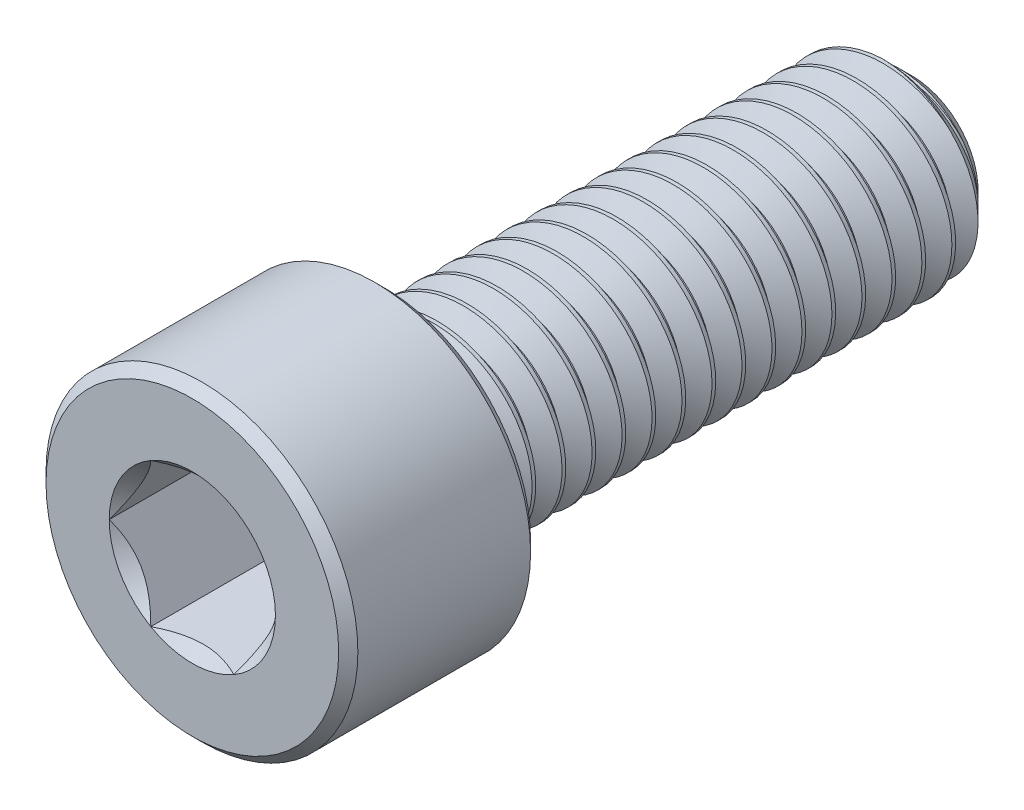
from build123d import *

# Parameters (mm, degrees)
CUT_EXTRUDE1_DEPTH = 7
CUT_SWEEP1_PITCH   = 1.25
CUT_SWEEP1_TO      = 22


with BuildPart() as part:
    # Sketch2 → Revolve1 (revolve)
    with BuildSketch(Plane(origin=(0, 0, 0), x_dir=(0, 0, -1), z_dir=(1, 0, 0)), mode=Mode.PRIVATE) as revolve1_sk:
        Polygon((-15, 0), (-15, 6.1), (-14.6, 6.5), (-7.4, 6.5), (-7, 6.1), (-7, 4), (13.75, 4), (15, 2.75), (15, 0), align=None)
    revolve(revolve1_sk.sketch.rotate(Axis((0, 0, -15), (0, 0, 1)), 90), axis=Axis((0, 0, -15), (0, 0, 1)))

    # Sketch3 → Cut-Extrude1 (cut)
    with BuildSketch(Plane.XY.offset(15)):
        Polygon((1.732050808, 3), (-1.732050808, 3), (-3.464101615, 0), (-1.732050808, -3), (1.732050808, -3), (3.464101615, 0), align=None)
    extrude(amount=-CUT_EXTRUDE1_DEPTH, mode=Mode.SUBTRACT)

    # Cut-Extrude2 cone 1 section (through the dimple's axis) → Cut-Extrude2 (revolve, cut)
    with BuildSketch(Plane(origin=(0, 0, 15), x_dir=(0, -1, 0), z_dir=(1, 0, 0))):
        Polygon((0, 0), (3.464101615, 0), (0, 3.464101615), align=None)
    revolve(axis=Axis((0, 0, 15), (0, 0, -1)), mode=Mode.SUBTRACT)


with BuildPart() as body_2:
    # Split1: read off the stored shape, not the designer's step
    # Split1: the piece on the far side of the plane
    add(part.part)
    split(bisect_by=Plane.XY.offset(7), keep=Keep.BOTTOM)

    # Cut-Sweep1: arcs per turn and ends read off the stored shape
    # Cut-Sweep1: the profile of Sketch7 screwed along a right-hand helix through 18.6 turns, 8 arcs to a turn; built about Z, then put on its axis
    cut_sweep1_z = Axis((0, 0, 0), (0, 0, 1))
    cut_sweep1_corners = [(4.067658235, 0, 0.0390625), (4.067658235, 0, -1.1328125), (3.188101184, 0, -0.625), (3.188101184, 0, -0.46875)]
    with BuildLine(mode=Mode.PRIVATE) as cut_sweep1_profile:
        Line(cut_sweep1_corners[0], cut_sweep1_corners[1])
        Line(cut_sweep1_corners[1], cut_sweep1_corners[2])
        Line(cut_sweep1_corners[2], cut_sweep1_corners[3])
        Line(cut_sweep1_corners[3], cut_sweep1_corners[0])
    cut_sweep1_cap = Face(cut_sweep1_profile.wire())
    cut_sweep1_turn_angles = [0, 22.5, 45, 67.5, 90, 112.5, 135, 157.5, 180, 202.5, 225, 247.5, 270, 292.5, 315, 337.5, 360]
    cut_sweep1_turn_weights = [1, 0.9238795325112867, 1, 0.9238795325112867, 1, 0.9238795325112867, 1, 0.9238795325112867, 1, 0.9238795325112867, 1, 0.9238795325112867, 1, 0.9238795325112867, 1, 0.9238795325112867, 1]
    cut_sweep1_turn_rails = [Edge.make_bspline([Vector(p[0], p[1], 0).rotate(cut_sweep1_z, cut_sweep1_turn_angles[k]) / cut_sweep1_turn_weights[k] + Vector(0, 0, p[2] + CUT_SWEEP1_PITCH * cut_sweep1_turn_angles[k] / 360) for k in range(17)], [0, 0, 0, 1, 1, 2, 2, 3, 3, 4, 4, 5, 5, 6, 6, 7, 7, 8, 8, 8], 2, cut_sweep1_turn_weights) for p in cut_sweep1_corners]
    cut_sweep1_turn_sides = [Face.make_surface_from_curves(cut_sweep1_turn_rails[p[0]], cut_sweep1_turn_rails[p[1]]) for p in [(0, 1), (1, 2), (2, 3), (3, 0)]]
    cut_sweep1_last_angles = [6480, 6502.5, 6525, 6547.5, 6570, 6592.5, 6615, 6637.5, 6660, 6678, 6696]
    cut_sweep1_last_weights = [1, 0.9238795325112867, 1, 0.9238795325112867, 1, 0.9238795325112867, 1, 0.9238795325112867, 1, 0.9510565162950236, 1]
    cut_sweep1_last_rails = [Edge.make_bspline([Vector(p[0], p[1], 0).rotate(cut_sweep1_z, cut_sweep1_last_angles[k]) / cut_sweep1_last_weights[k] + Vector(0, 0, p[2] + CUT_SWEEP1_PITCH * cut_sweep1_last_angles[k] / 360) for k in range(11)], [0, 0, 0, 1, 1, 2, 2, 3, 3, 4, 4, 5, 5, 5], 2, cut_sweep1_last_weights) for p in cut_sweep1_corners]
    cut_sweep1_last_sides = [Face.make_surface_from_curves(cut_sweep1_last_rails[p[0]], cut_sweep1_last_rails[p[1]]) for p in [(0, 1), (1, 2), (2, 3), (3, 0)]]
    cut_sweep1 = Plane(origin=(0, 0, -15), x_dir=(0, 1, 0), z_dir=(0, 0, 1)) * split(Solid(Shell([*[p.moved(Location((0, 0, CUT_SWEEP1_PITCH * i))) for i in range(18) for p in cut_sweep1_turn_sides], *cut_sweep1_last_sides, cut_sweep1_cap, cut_sweep1_cap.rotate(cut_sweep1_z, 6696).moved(Location((0, 0, CUT_SWEEP1_PITCH * 6696 / 360)))])), bisect_by=Plane.XY.offset(CUT_SWEEP1_TO), keep=Keep.BOTTOM, mode=Mode.PRIVATE)
    add(cut_sweep1, mode=Mode.SUBTRACT)


with BuildPart() as part_1:
    add(part.part)

    # Split1
    split(bisect_by=Plane.XY.offset(7), keep=Keep.TOP)

    add(body_2.part)  # Boss-Extrude1 merges body 2
    # Boss-Extrude1: read off the stored shape, not the designer's step
    # Boss-Extrude1 outline → Boss-Extrude1 (revolve)
    with BuildSketch(Plane.XZ):
        Polygon((3.18808947, 7), (3.18808947, 6.712487402), (4, 7), align=None)
    revolve(axis=Axis((0, 0, 0), (0, 0, 1)))


solid = part_1.part
